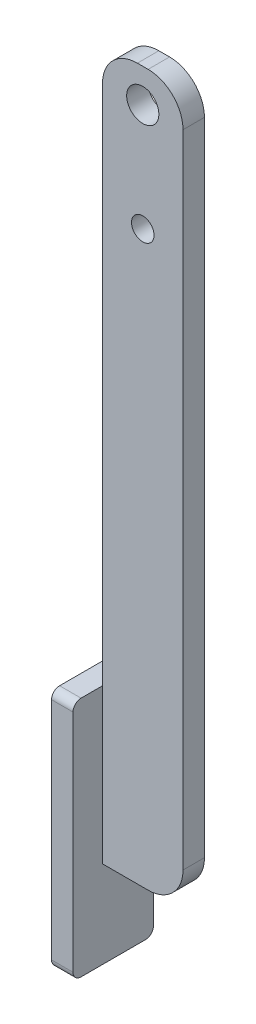
from build123d import *

# Parameters (mm, degrees)
SKETCH1_W           = 30
SKETCH1_H           = 265
SKETCH1_R           = 4.2
SKETCH1_R_2         = 6
BOSS_EXTRUDE1_DEPTH = 4
FILLET1_R           = 13
SKETCH2_W           = 30
SKETCH2_H           = 90
BOSS_EXTRUDE2_DEPTH = 8
SKETCH3_R           = 5.736099449
CUT_EXTRUDE1_DEPTH  = 1
FILLET2_R           = 3
FILLET3_R           = 13


with BuildPart() as part:
    # Sketch1 → Boss-Extrude1 (new, symmetric)
    with BuildSketch(Plane.XY):
        with Locations((0, -120)):
            Rectangle(SKETCH1_W, SKETCH1_H)
        with Locations((0, -40)):
            Circle(SKETCH1_R, mode=Mode.SUBTRACT)
        Circle(SKETCH1_R_2, mode=Mode.SUBTRACT)
    extrude(amount=BOSS_EXTRUDE1_DEPTH, both=True)

    # Fillet1
    fillet1_edges = [part.edges().sort_by_distance(p)[0] for p in [
        (15, 12.5, 0),
        (-15, 12.5, 0),
    ]]
    fillet(fillet1_edges, radius=FILLET1_R)

    # Sketch2 → Boss-Extrude2 (add)
    with BuildSketch(Plane.ZY.offset(15)):
        with Locations((0, -240)):
            Rectangle(SKETCH2_W, SKETCH2_H)
    extrude(amount=BOSS_EXTRUDE2_DEPTH)

    # Sketch3 → Cut-Extrude1 (cut)
    with BuildSketch(Plane.ZY.offset(23)):
        with Locations((0, -240)):
            Circle(SKETCH3_R)
    extrude(amount=-CUT_EXTRUDE1_DEPTH, mode=Mode.SUBTRACT)

    # Fillet2
    fillet2_edges = [part.edges().sort_by_distance(p)[0] for p in [
        (-19, -285, -15),
        (-19, -285, 15),
        (-19, -195, -15),
        (-19, -195, 15),
    ]]
    fillet(fillet2_edges, radius=FILLET2_R)

    # Fillet3
    fillet3_edges = [part.edges().sort_by_distance(p)[0] for p in [
        (15, -252.5, 0),
    ]]
    fillet(fillet3_edges, radius=FILLET3_R)


solid = part.part
